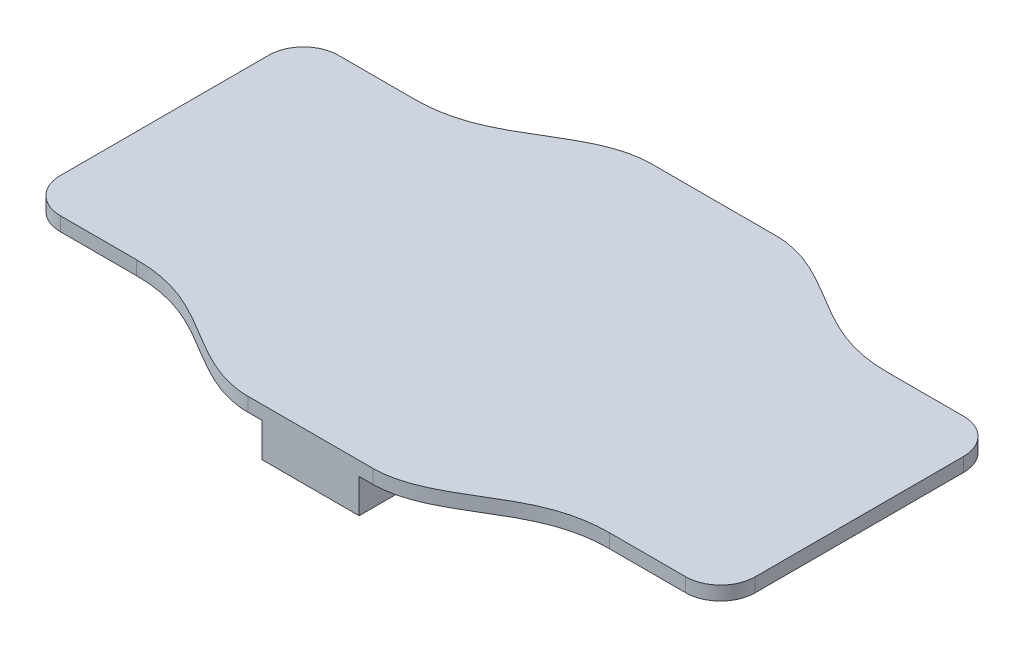
from build123d import *

# Parameters (mm, degrees)
BOSS_EXTRUDE1_DEPTH = 10
FILLET1_R           = 25
SKETCH3_W           = 70
SKETCH3_H           = 80
BOSS_EXTRUDE2_DEPTH = 24.5


# Read off the part's stored shape, not the designer's step: Boss-Extrude1
with BuildPart() as part:
    # Boss-Extrude1 outline → Boss-Extrude1 (new body)
    with BuildSketch(Plane(origin=(0, 0, 0), x_dir=(1, 0, 0), z_dir=(0, 1, 0))):
        with BuildLine():
            Line((-250, -100), (-170, -100))
            add(Edge.make_bspline(
                [(-170, -100), (-120, -100), (-100, -130), (-70, -145), (-45, -145)],
                knots=[0, 0, 0, 0, 0, 1, 1, 1, 1, 1], degree=4))
            Line((-45, -145), (45, -145))
            add(Edge.make_bspline(
                [(45, -145), (70, -145), (100, -130), (120, -100), (170, -100)],
                knots=[0, 0, 0, 0, 0, 1, 1, 1, 1, 1], degree=4))
            Line((170, -100), (250, -100))
            Line((250, -100), (250, 100))
            Line((250, 100), (170, 100))
            add(Edge.make_bspline(
                [(170, 100), (120, 100), (100, 130), (70, 145), (45, 145)],
                knots=[0, 0, 0, 0, 0, 1, 1, 1, 1, 1], degree=4))
            Line((45, 145), (-45, 145))
            add(Edge.make_bspline(
                [(-45, 145), (-70, 145), (-100, 130), (-120, 100), (-170, 100)],
                knots=[0, 0, 0, 0, 0, 1, 1, 1, 1, 1], degree=4))
            Line((-170, 100), (-250, 100))
            Line((-250, 100), (-250, -100))
        make_face()
    extrude(amount=BOSS_EXTRUDE1_DEPTH)

    # Fillet1
    fillet1_edges = [part.edges().sort_by_distance(p)[0] for p in [
        (-250, 5, 100),
        (-250, 5, -100),
        (250, 5, -100),
        (250, 5, 100),
    ]]
    fillet(fillet1_edges, radius=FILLET1_R)

    # Sketch3 → Boss-Extrude2 (add)
    with BuildSketch(Plane.XZ):
        with Locations((0, -105)):
            Rectangle(SKETCH3_W, SKETCH3_H)
        with Locations((0, 105)):
            Rectangle(SKETCH3_W, SKETCH3_H)
    extrude(amount=BOSS_EXTRUDE2_DEPTH)


solid = part.part
